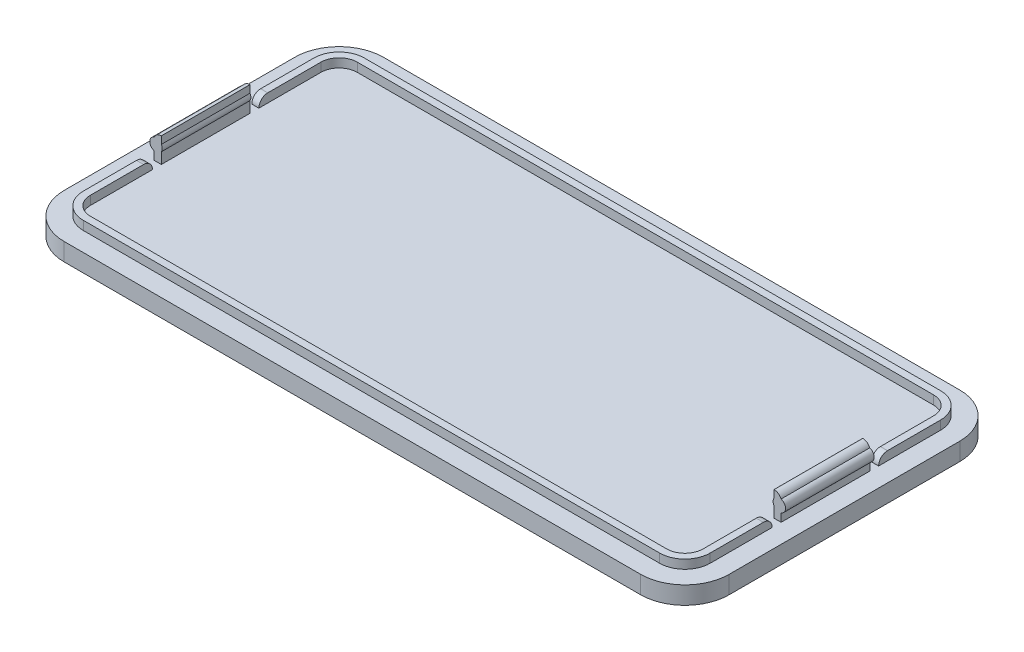
from build123d import *

# Parameters (mm, degrees)
EXTRUDE_2_DEPTH     = 2
EXTRUDE_4_DEPTH     = 1
SKETCH_7_W          = 0.8
SKETCH_7_H          = 10
EXTRUDE_8_DEPTH     = 2.8
SKETCH_8_R          = 0.7
EXTRUDE_9_DEPTH     = 10
FILLET_1_R          = 0.85
SKETCH_11_W         = 1
SKETCH_11_H         = 1
CUT_EXTRUDE_1_DEPTH = 1.2
FILLET_2_R          = 1
SKETCH_12_W         = 0.815007945
SKETCH_12_H         = 4.86663949
CUT_EXTRUDE_2_DEPTH = 0.5
SKETCH_13_W         = 0.8
SKETCH_13_H         = 10
EXTRUDE_10_DEPTH    = 1.8
SKETCH_14_R         = 0.7
EXTRUDE_11_DEPTH    = 10
FILLET_3_R          = 0.85
SKETCH_15_W         = 0.8
SKETCH_15_H         = 1
CUT_EXTRUDE_3_DEPTH = 1
FILLET_4_R          = 1


# Some blends are built 0.0001 mm under size
with BuildPart() as part:
    # case 2 → 凸台-拉伸2 (new body)
    with BuildSketch(Plane(origin=(0, 0, 0), x_dir=(1, 0, 0), z_dir=(0, 1, 0))):
        with BuildLine():
            Line((-34.042196447, 18), (30.957803553, 18))
            ThreePointArc((30.957803553, 18), (34.493337459, 16.535533906), (35.957803553, 13))
            Line((35.957803553, 13), (35.957803553, -13))
            ThreePointArc((35.957803553, -13), (34.493337459, -16.535533906), (30.957803553, -18))
            Line((30.957803553, -18), (-34.042196447, -18))
            ThreePointArc((-34.042196447, -18), (-37.577730353, -16.535533906), (-39.042196447, -13))
            Line((-39.042196447, -13), (-39.042196447, 13))
            ThreePointArc((-39.042196447, 13), (-37.577730353, 16.535533906), (-34.042196447, 18))
        make_face()
    extrude(amount=EXTRUDE_2_DEPTH)

    # 草图3 → 凸台-拉伸4 (add)
    with BuildSketch(Plane(origin=(0, 2, 0), x_dir=(1, 0, 0), z_dir=(0, 1, 0))):
        with BuildLine():
            Line((-36.892196447, 13), (-36.892196447, -13))
            ThreePointArc((-36.892196447, -13), (-36.057450774, -15.015254326), (-34.042196447, -15.85))
            Line((-34.042196447, -15.85), (30.957803553, -15.85))
            ThreePointArc((30.957803553, -15.85), (32.973057879, -15.015254326), (33.807803553, -13))
            Line((33.807803553, -13), (33.807803553, 13))
            ThreePointArc((33.807803553, 13), (32.973057879, 15.015254326), (30.957803553, 15.85))
            Line((30.957803553, 15.85), (-34.042196447, 15.85))
            ThreePointArc((-34.042196447, 15.85), (-36.057450774, 15.015254326), (-36.892196447, 13))
        make_face()
        with BuildLine():
            Line((-34.042196447, -15.05), (30.957803553, -15.05))
            ThreePointArc((30.957803553, -15.05), (32.407372454, -14.449568901), (33.007803553, -13))
            Line((33.007803553, -13), (33.007803553, 13))
            ThreePointArc((33.007803553, 13), (32.407372454, 14.449568901), (30.957803553, 15.05))
            Line((30.957803553, 15.05), (-34.042196447, 15.05))
            ThreePointArc((-34.042196447, 15.05), (-35.491765349, 14.449568901), (-36.092196447, 13))
            Line((-36.092196447, 13), (-36.092196447, -13))
            ThreePointArc((-36.092196447, -13), (-35.491765349, -14.449568901), (-34.042196447, -15.05))
        make_face(mode=Mode.SUBTRACT)
    extrude(amount=EXTRUDE_4_DEPTH)

    # 草图7 → 凸台-拉伸8 (add)
    with BuildSketch(Plane(origin=(0, 2, 0), x_dir=(1, 0, 0), z_dir=(0, 1, 0))):
        with Locations((-36.492196447, 0)):
            Rectangle(SKETCH_7_W, SKETCH_7_H)
    extrude(amount=EXTRUDE_8_DEPTH)

    # 草图8 → 凸台-拉伸9 (add)
    with BuildSketch(Plane.XY.offset(5)):
        with Locations((-36.692196447, 3.6)):
            Circle(SKETCH_8_R)
    extrude(amount=-EXTRUDE_9_DEPTH)

    # 圆角1
    # the kernel refuses this fillet: 0.85 mm, written as the material it takes off along each edge
    with BuildSketch(Plane(origin=(-36.892196447, 4.8, 6.967826014), x_dir=(0, -1, 0), z_dir=(0, 0, -1))) as fillet_1_piece_1:
        with BuildLine():
            CenterArc((0.85, -0.787130406), FILLET_1_R, 112.174937704, 67.825062296)
            Line((0, -0.787130406), (-0.017, -0.787130406))
            Line((-0.017, -0.787130406), (-0.017, 0))
            Line((-0.017, 0), (0, 0.017))
            ThreePointArc((0, 0.017), (0.264589803, 0.017), (0.522763199, 0.015742608))
            Line((0.522763199, 0.015742608), (0.529179607, 0))
        make_face()
    extrude(amount=13.935652028, mode=Mode.SUBTRACT)

    # 草图11 → 切除-拉伸1 (cut)
    with BuildSketch(Plane.ZY.offset(36.892196447)):
        with Locations((5.5, 2.5)):
            Rectangle(SKETCH_11_W, SKETCH_11_H)
        with Locations((-5.5, 2.5)):
            Rectangle(SKETCH_11_W, SKETCH_11_H)
    extrude(amount=-CUT_EXTRUDE_1_DEPTH, mode=Mode.SUBTRACT)

    # 圆角2
    fillet_2_edges = [part.edges().sort_by_distance(p)[0] for p in [
        (-36.492196447, 3, 6),
        (-36.492196447, 3, -6),
    ]]
    fillet(fillet_2_edges, radius=FILLET_2_R - 0.0001)  # a hair under: the kernel refuses the full size

    # 草图12 → 切除-拉伸2 (cut)
    # profile 1 of 9: a face of its own
    with BuildSketch(Plane(origin=(0, 0, 0), x_dir=(-1, 0, 0), z_dir=(0, -1, 0))):
        with BuildLine():
            Line((-8.199275743, 5.02603156), (-9.01984878, 5.499029726))
            Line((-9.01984878, 5.499029726), (-13.276727931, 7.955148964))
            Line((-13.276727931, 7.955148964), (-14.097300969, 8.433851351))
            add(Edge.make_bspline(
                [(-14.097300969, 8.433851351), (-14.365190658, 8.581987184), (-14.661462323, 8.661776712), (-14.957803553, 8.661776712)],
                knots=[3, 3, 3, 3, 4, 4, 4, 4], degree=3))
            add(Edge.make_bspline(
                [(-14.957803553, 8.661776712), (-15.254144782, 8.661776712), (-15.550486011, 8.581987184), (-15.818306136, 8.433851351)],
                knots=[4, 4, 4, 4, 5, 5, 5, 5], degree=3))
            Line((-15.818306136, 8.433851351), (-16.638948738, 7.955148964))
            Line((-16.638948738, 7.955148964), (-20.895827889, 5.499029726))
            Line((-20.895827889, 5.499029726), (-21.71647049, 5.02603156))
            add(Edge.make_bspline(
                [(-21.71647049, 5.02603156), (-22.24640652, 4.718316671), (-22.576973074, 4.148451095), (-22.576973074, 3.538690756)],
                knots=[8, 8, 8, 8, 9, 9, 9, 9], degree=3))
            Line((-22.576973074, 3.538690756), (-22.576973074, -3.276914044))
            add(Edge.make_bspline(
                [(-22.576973074, -3.276914044), (-22.576973074, -3.892343823), (-22.24640652, -4.456539959), (-21.71647049, -4.764254848)],
                knots=[10, 10, 10, 10, 11, 11, 11, 11], degree=3))
            Line((-21.71647049, -4.764254848), (-20.895827889, -5.237253014))
            Line((-20.895827889, -5.237253014), (-16.638948738, -7.693372252))
            Line((-16.638948738, -7.693372252), (-15.818306136, -8.172039857))
            add(Edge.make_bspline(
                [(-15.818306136, -8.172039857), (-15.550486011, -8.325914693), (-15.254144782, -8.4), (-14.957803553, -8.4)],
                knots=[14, 14, 14, 14, 15, 15, 15, 15], degree=3))
            add(Edge.make_bspline(
                [(-14.957803553, -8.4), (-14.661462323, -8.4), (-14.365190658, -8.325914693), (-14.097300969, -8.172039857)],
                knots=[15, 15, 15, 15, 16, 16, 16, 16], degree=3))
            Line((-14.097300969, -8.172039857), (-13.276727931, -7.693372252))
            Line((-13.276727931, -7.693372252), (-9.01984878, -5.237253014))
            Line((-9.01984878, -5.237253014), (-8.199275743, -4.764254848))
            add(Edge.make_bspline(
                [(-8.199275743, -4.764254848), (-7.663565929, -4.456539959), (-7.338773159, -3.892343823), (-7.338773159, -3.276914044)],
                knots=[19, 19, 19, 19, 20, 20, 20, 20], degree=3))
            Line((-7.338773159, -3.276914044), (-7.338773159, 3.538690756))
            add(Edge.make_bspline(
                [(-7.338773159, 3.538690756), (-7.338773159, 4.148451095), (-7.663565929, 4.718316671), (-8.199275743, 5.02603156)],
                knots=[21, 21, 21, 21, 22, 22, 22, 22], degree=3))
        make_face()
        with BuildLine():
            Line((-20.622303543, 4.347890134), (-15.356751194, 7.390987609))
            add(Edge.make_bspline(
                [(-15.356751194, 7.390987609), (-15.111678388, 7.533454003), (-14.803928717, 7.533454003), (-14.553221255, 7.390987609)],
                knots=[3, 3, 3, 3, 4, 4, 4, 4], degree=3))
            Line((-14.553221255, 7.390987609), (-9.31619001, 4.342185913))
            add(Edge.make_bspline(
                [(-9.31619001, 4.342185913), (-9.048369885, 4.188345859), (-9.042665664, 3.800841442), (-9.310485789, 3.641262386)],
                knots=[5, 5, 5, 5, 6, 6, 6, 6], degree=3))
            Line((-9.310485789, 3.641262386), (-14.399346419, 0.598199692))
            add(Edge.make_bspline(
                [(-14.399346419, 0.598199692), (-14.741321415, 0.398725872), (-15.168720597, 0.398725872), (-15.510626029, 0.598199692)],
                knots=[7, 7, 7, 7, 8, 8, 8, 8], degree=3))
            add(Edge.make_bspline(
                [(-15.510626029, 0.598199692), (-20.662163525, 3.572881299), (-20.673571967, 3.57858552)],
                knots=[0, 0, 0, 1, 1, 1], degree=2))
            add(Edge.make_bspline(
                [(-20.673571967, 3.57858552), (-20.941392092, 3.772320338), (-20.912940551, 4.182641639), (-20.622303543, 4.347890134)],
                knots=[1, 1, 1, 1, 2, 2, 2, 2], degree=3))
        make_face(mode=Mode.SUBTRACT)
        with BuildLine():
            Line((-12.820807646, -4.559111588), (-13.413490104, -4.889608579))
            Line((-13.413490104, -4.889608579), (-13.413490104, -3.806884855))
            Line((-13.413490104, -3.806884855), (-12.889258296, -3.544734169))
            add(Edge.make_bspline(
                [(-11.931853522, -2.159964996), (-11.931853522, -2.701344248), (-12.239533629, -3.180011854), (-12.889258296, -3.544734169)],
                knots=[0, 0, 0, 0, 1, 1, 1, 1], degree=3))
            add(Edge.make_bspline(
                [(-12.923414057, -1.971899617), (-12.285167396, -1.607212083), (-11.931853522, -1.601507862), (-11.931853522, -2.159964996)],
                knots=[6, 6, 6, 6, 7, 7, 7, 7], degree=3))
            Line((-12.923414057, -1.971899617), (-13.413490104, -2.245458745))
            add(Edge.make_bspline(
                [(-13.470532313, -2.342326153), (-13.470532313, -2.302431389), (-13.44771543, -2.262536625), (-13.413490104, -2.245458745)],
                knots=[4, 4, 4, 4, 5, 5, 5, 5], degree=3))
            Line((-13.470532313, -2.342326153), (-13.470532313, -3.687200563))
            Line((-13.470532313, -3.687200563), (-13.470532313, -4.98651077))
            Line((-13.470532313, -4.98651077), (-13.470532313, -6.696107495))
            add(Edge.make_bspline(
                [(-13.470532313, -6.696107495), (-13.470532313, -6.736002259), (-13.487575412, -6.770192803), (-13.527435394, -6.792974904)],
                knots=[3, 3, 3, 3, 4, 4, 4, 4], degree=3))
            Line((-13.527435394, -6.792974904), (-14.633010783, -7.419813124))
            add(Edge.make_bspline(
                [(-14.633010783, -7.419813124), (-14.70709609, -7.459707888), (-14.79829406, -7.408439464), (-14.79829406, -7.322945715)],
                knots=[5, 5, 5, 5, 6, 6, 6, 6], degree=3))
            Line((-14.79829406, -7.322945715), (-14.79829406, -2.045984924))
            add(Edge.make_bspline(
                [(-14.79829406, -2.045984924), (-14.79829406, -2.00609016), (-14.781181398, -1.966195396), (-14.741321415, -1.949117515)],
                knots=[7, 7, 7, 7, 8, 8, 8, 8], degree=3))
            Line((-14.741321415, -1.949117515), (-12.860737192, -0.883471672))
            add(Edge.make_bspline(
                [(-12.860737192, -0.883471672), (-11.641216513, -0.193921805), (-10.632612879, -0.057159632), (-10.632612879, -1.424850925)],
                knots=[9, 9, 9, 9, 10, 10, 10, 10], degree=3))
            add(Edge.make_bspline(
                [(-10.632612879, -1.424850925), (-10.632612879, -2.741239012), (-11.652624955, -3.898048043), (-12.820807646, -4.559111588)],
                knots=[10, 10, 10, 10, 11, 11, 11, 11], degree=3))
        make_face(mode=Mode.SUBTRACT)
        with BuildLine():
            Line((-8.917311932, -4.205797714), (-10.011409316, -4.826931714))
            add(Edge.make_bspline(
                [(-10.011409316, -4.826931714), (-10.085494623, -4.866826478), (-10.176692593, -4.815523272), (-10.176692593, -4.730064305)],
                knots=[2, 2, 2, 2, 3, 3, 3, 3], degree=3))
            Line((-10.176692593, -4.730064305), (-10.176692593, -2.21693764))
            add(Edge.make_bspline(
                [(-10.176692593, -2.21693764), (-10.176692593, -2.177077658), (-10.15387571, -2.142852333), (-10.119650385, -2.120070231)],
                knots=[4, 4, 4, 4, 5, 5, 5, 5], degree=3))
            Line((-10.119650385, -2.120070231), (-9.025553001, -1.504605671))
            add(Edge.make_bspline(
                [(-9.025553001, -1.504605671), (-8.951467694, -1.464745689), (-8.860269724, -1.516014113), (-8.860269724, -1.601507862)],
                knots=[6, 6, 6, 6, 7, 7, 7, 7], degree=3))
            Line((-8.860269724, -1.601507862), (-8.860269724, -4.108895524))
            add(Edge.make_bspline(
                [(-8.860269724, -4.108895524), (-8.860269724, -4.148790288), (-8.883086607, -4.188685052), (-8.917311932, -4.205797714)],
                knots=[0, 0, 0, 0, 1, 1, 1, 1], degree=3))
        make_face(mode=Mode.SUBTRACT)
        with BuildLine():
            add(Edge.make_bspline(
                [(-9.515629048, 0.16509629), (-9.076821425, 0.415838534), (-8.763437097, 0.307562684), (-8.763437097, -0.091350175), (-8.763437097, -0.484558813), (-9.076821425, -0.946148538), (-9.515629048, -1.191186561)],
                knots=[2, 2, 2, 2, 3, 3, 3, 4, 4, 4, 4], degree=3))
            add(Edge.make_bspline(
                [(-9.515629048, -1.191186561), (-9.960071328, -1.447633027), (-10.27352522, -1.339357176), (-10.27352522, -0.946148538), (-10.27352522, -0.541531458), (-9.960071328, -0.085645954), (-9.515629048, 0.16509629)],
                knots=[0, 0, 0, 0, 1, 1, 1, 2, 2, 2, 2], degree=3))
        make_face(mode=Mode.SUBTRACT)
    # profile 2 of 9: a face of its own
    with BuildSketch(Plane(origin=(0, 0, 0), x_dir=(-1, 0, 0), z_dir=(0, -1, 0))):
        with BuildLine():
            Line((-3.344009912, 3.059988369), (-5.218889915, 3.059988369))
            Line((-5.218889915, 3.059988369), (-5.218889915, -3.504839405))
            Line((-5.218889915, -3.504839405), (-4.386838872, -3.504839405))
            Line((-4.386838872, -3.504839405), (-4.386838872, -0.900549553))
            Line((-4.386838872, -0.900549553), (-3.298376145, -0.900549553))
            add(Edge.make_bspline(
                [(-3.298376145, -0.900549553), (-1.868007986, -0.900549553), (-0.882151672, -0.250929231), (-0.882151672, 1.133874724)],
                knots=[5, 5, 5, 5, 6, 6, 6, 6], degree=3))
            add(Edge.make_bspline(
                [(-0.882151672, 1.133874724), (-0.882151672, 2.569912322), (-1.868007986, 3.059988369), (-3.344009912, 3.059988369)],
                knots=[6, 6, 6, 6, 7, 7, 7, 7], degree=3))
        make_face()
        with BuildLine():
            Line((-3.406617214, -0.228112348), (-4.386838872, -0.228112348))
            Line((-4.386838872, -0.228112348), (-4.386838872, 2.387551164))
            Line((-4.386838872, 2.387551164), (-3.440842539, 2.387551164))
            add(Edge.make_bspline(
                [(-3.440842539, 2.387551164), (-2.289702947, 2.387551164), (-1.70842893, 2.085540496), (-1.70842893, 1.133874724)],
                knots=[3, 3, 3, 3, 4, 4, 4, 4], degree=3))
            add(Edge.make_bspline(
                [(-1.70842893, 1.133874724), (-1.70842893, 0.193582612), (-2.249842965, -0.228112348), (-3.406617214, -0.228112348)],
                knots=[4, 4, 4, 4, 5, 5, 5, 5], degree=3))
        make_face(mode=Mode.SUBTRACT)
    # profile 3 of 9: a face of its own
    with BuildSketch(Plane(origin=(0, 0, 0), x_dir=(-1, 0, 0), z_dir=(0, -1, 0))):
        with Locations((0.602337022, -1.07151966)):
            Rectangle(SKETCH_12_W, SKETCH_12_H)
    # profile 4 of 9: a face of its own
    with BuildSketch(Plane(origin=(0, 0, 0), x_dir=(-1, 0, 0), z_dir=(0, -1, 0))):
        with BuildLine():
            Line((5.716866646, 0.2847458), (4.884885167, 0.615277573))
            add(Edge.make_bspline(
                [(4.884885167, 0.615277573), (4.297906929, 0.848941937), (3.876211968, 0.99140833), (3.876211968, 1.361800085)],
                knots=[1, 1, 1, 1, 2, 2, 2, 2], degree=3))
            add(Edge.make_bspline(
                [(3.876211968, 1.361800085), (3.876211968, 1.715113959), (4.178257418, 1.91458778), (4.674037686, 1.91458778)],
                knots=[2, 2, 2, 2, 3, 3, 3, 3], degree=3))
            add(Edge.make_bspline(
                [(4.674037686, 1.91458778), (5.192565274, 1.91458778), (5.602921356, 1.737930843), (6.041659416, 1.401694849)],
                knots=[3, 3, 3, 3, 4, 4, 4, 4], degree=3))
            Line((6.041659416, 1.401694849), (6.839554697, 2.404663827))
            add(Edge.make_bspline(
                [(6.839554697, 2.404663827), (6.25828068, 2.991607282), (5.4433423, 3.287948512), (4.674037686, 3.287948512)],
                knots=[5, 5, 5, 5, 6, 6, 6, 6], degree=3))
            add(Edge.make_bspline(
                [(4.674037686, 3.287948512), (3.255077969, 3.287948512), (2.252108992, 2.387551164), (2.252108992, 1.270636897)],
                knots=[6, 6, 6, 6, 7, 7, 7, 7], degree=3))
            add(Edge.make_bspline(
                [(2.252108992, 1.270636897), (2.252108992, 0.301858463), (2.907398752, -0.279415554), (3.608391843, -0.558644121)],
                knots=[7, 7, 7, 7, 8, 8, 8, 8], degree=3))
            Line((3.608391843, -0.558644121), (4.457485985, -0.917662216))
            add(Edge.make_bspline(
                [(4.457485985, -0.917662216), (5.02735156, -1.156996018), (5.397778097, -1.282384531), (5.397778097, -1.669888949)],
                knots=[9, 9, 9, 9, 10, 10, 10, 10], degree=3))
            add(Edge.make_bspline(
                [(5.397778097, -1.669888949), (5.397778097, -2.028907043), (5.11854953, -2.251128184), (4.525867072, -2.251128184)],
                knots=[10, 10, 10, 10, 11, 11, 11, 11], degree=3))
            add(Edge.make_bspline(
                [(4.525867072, -2.251128184), (4.001635263, -2.251128184), (3.3804317, -1.971899617), (2.907398752, -1.567317319)],
                knots=[11, 11, 11, 11, 12, 12, 12, 12], degree=3))
            Line((2.907398752, -1.567317319), (2.001401529, -2.672857926))
            add(Edge.make_bspline(
                [(2.001401529, -2.672857926), (2.690916615, -3.305400367), (3.625434942, -3.630227918), (4.491641747, -3.630227918)],
                knots=[13, 13, 13, 13, 14, 14, 14, 14], degree=3))
            add(Edge.make_bspline(
                [(4.491641747, -3.630227918), (6.104405845, -3.630227918), (7.038924172, -2.655745263), (7.038924172, -1.544500435)],
                knots=[14, 14, 14, 14, 15, 15, 15, 15], degree=3))
            add(Edge.make_bspline(
                [(7.038924172, -1.544500435), (7.038924172, -0.604243106), (6.543213468, -0.04575119), (5.716866646, 0.2847458)],
                knots=[15, 15, 15, 15, 16, 16, 16, 16], degree=3))
        make_face()
    # profile 5 of 9: a face of its own
    with BuildSketch(Plane(origin=(0, 0, 0), x_dir=(-1, 0, 0), z_dir=(0, -1, 0))):
        with BuildLine():
            Line((10.822909503, 1.589760228), (10.822909503, -1.749678477))
            add(Edge.make_bspline(
                [(10.822909503, -1.749678477), (10.555089378, -2.125774452), (10.332763892, -2.268240846), (9.973815361, -2.268240846)],
                knots=[1, 1, 1, 1, 2, 2, 2, 2], degree=3))
            add(Edge.make_bspline(
                [(9.973815361, -2.268240846), (9.569163499, -2.268240846), (9.381132902, -2.068801808), (9.381132902, -1.362139278)],
                knots=[2, 2, 2, 2, 3, 3, 3, 3], degree=3))
            Line((9.381132902, -1.362139278), (9.381132902, 1.589760228))
            Line((9.381132902, 1.589760228), (7.791185687, 1.589760228))
            Line((7.791185687, 1.589760228), (7.791185687, -1.561613098))
            add(Edge.make_bspline(
                [(7.791185687, -1.561613098), (7.791185687, -2.8324022), (8.264218635, -3.630227918), (9.375428681, -3.630227918)],
                knots=[6, 6, 6, 6, 7, 7, 7, 7], degree=3))
            add(Edge.make_bspline(
                [(9.375428681, -3.630227918), (10.070647988, -3.630227918), (10.549385157, -3.305400367), (10.971080117, -2.803915878)],
                knots=[7, 7, 7, 7, 8, 8, 8, 8], degree=3))
            Line((10.971080117, -2.803915878), (11.005235879, -2.803915878))
            Line((11.005235879, -2.803915878), (11.119250732, -3.504839405))
            Line((11.119250732, -3.504839405), (12.418491375, -3.504839405))
            Line((12.418491375, -3.504839405), (12.418491375, 1.589760228))
            Line((12.418491375, 1.589760228), (10.822909503, 1.589760228))
        make_face()
    # profile 6 of 9: a face of its own
    with BuildSketch(Plane(origin=(0, 0, 0), x_dir=(-1, 0, 0), z_dir=(0, -1, 0))):
        with BuildLine():
            Line((16.270788228, -2.501870428), (15.467258289, -2.501870428))
            add(Edge.make_bspline(
                [(15.467258289, -2.501870428), (14.920209598, -2.501870428), (14.715066338, -2.393594577), (14.715066338, -2.159964996)],
                knots=[1, 1, 1, 1, 2, 2, 2, 2], degree=3))
            add(Edge.make_bspline(
                [(14.715066338, -2.159964996), (14.715066338, -1.989012279), (14.75492632, -1.909222751), (14.874575831, -1.800946901)],
                knots=[2, 2, 2, 2, 3, 3, 3, 3], degree=3))
            add(Edge.make_bspline(
                [(14.874575831, -1.800946901), (15.096901316, -1.863623766), (15.301975012, -1.892144871), (15.47296251, -1.892144871)],
                knots=[3, 3, 3, 3, 4, 4, 4, 4], degree=3))
            add(Edge.make_bspline(
                [(15.47296251, -1.892144871), (16.601285219, -1.892144871), (17.507421569, -1.373547719), (17.507421569, -0.182548145)],
                knots=[4, 4, 4, 4, 5, 5, 5, 5], degree=3))
            add(Edge.make_bspline(
                [(17.507421569, -0.182548145), (17.507421569, 0.06252466), (17.44467514, 0.296154242), (17.364955175, 0.438620636)],
                knots=[5, 5, 5, 5, 6, 6, 6, 6], degree=3))
            Line((17.364955175, 0.438620636), (18.151302888, 0.438620636))
            Line((18.151302888, 0.438620636), (18.151302888, 1.589760228))
            Line((18.151302888, 1.589760228), (16.28219667, 1.589760228))
            add(Edge.make_bspline(
                [(16.28219667, 1.589760228), (16.048532306, 1.675219195), (15.769303739, 1.715113959), (15.47296251, 1.715113959)],
                knots=[9, 9, 9, 9, 10, 10, 10, 10], degree=3))
            add(Edge.make_bspline(
                [(15.47296251, 1.715113959), (14.373160906, 1.715113959), (13.341670824, 1.111057841), (13.341670824, -0.13694916)],
                knots=[10, 10, 10, 10, 11, 11, 11, 11], degree=3))
            add(Edge.make_bspline(
                [(13.341670824, -0.13694916), (13.341670824, -0.729596837), (13.672237378, -1.202595003), (14.03118591, -1.453337247)],
                knots=[11, 11, 11, 11, 12, 12, 12, 12], degree=3))
            Line((14.03118591, -1.453337247), (14.03118591, -1.487527791))
            add(Edge.make_bspline(
                [(14.03118591, -1.487527791), (13.700688919, -1.721157372), (13.467024555, -2.080175467), (13.467024555, -2.439193562)],
                knots=[13, 13, 13, 13, 14, 14, 14, 14], degree=3))
            add(Edge.make_bspline(
                [(13.467024555, -2.439193562), (13.467024555, -2.866592744), (13.666533158, -3.134447651), (13.934353283, -3.316808808)],
                knots=[14, 14, 14, 14, 15, 15, 15, 15], degree=3))
            Line((13.934353283, -3.316808808), (13.934353283, -3.362373012))
            add(Edge.make_bspline(
                [(13.934353283, -3.362373012), (13.461320335, -3.601741596), (13.210612872, -3.943647028), (13.210612872, -4.365341989)],
                knots=[16, 16, 16, 16, 17, 17, 17, 17], degree=3))
            add(Edge.make_bspline(
                [(13.210612872, -4.365341989), (13.210612872, -5.277112996), (14.173652304, -5.647539533), (15.347608779, -5.647539533)],
                knots=[17, 17, 17, 17, 18, 18, 18, 18], degree=3))
            add(Edge.make_bspline(
                [(15.347608779, -5.647539533), (17.11988237, -5.647539533), (18.23116198, -4.88393914), (18.23116198, -3.806884855)],
                knots=[18, 18, 18, 18, 19, 19, 19, 19], degree=3))
            add(Edge.make_bspline(
                [(18.23116198, -3.806884855), (18.23116198, -2.883705406), (17.524534232, -2.501870428), (16.270788228, -2.501870428)],
                knots=[19, 19, 19, 19, 20, 20, 20, 20], degree=3))
        make_face()
        with BuildLine():
            Line((15.484370952, -3.721391106), (15.968812342, -3.721391106))
            add(Edge.make_bspline(
                [(15.968812342, -3.721391106), (16.441706162, -3.721391106), (16.709595851, -3.784067972), (16.709595851, -4.086113422)],
                knots=[4, 4, 4, 4, 5, 5, 5, 5], degree=3))
            add(Edge.make_bspline(
                [(16.709595851, -4.086113422), (16.709595851, -4.410940974), (16.253745129, -4.650274776), (15.598316241, -4.650274776)],
                knots=[5, 5, 5, 5, 6, 6, 6, 6], degree=3))
            add(Edge.make_bspline(
                [(15.598316241, -4.650274776), (14.943026481, -4.650274776), (14.5156273, -4.473617839), (14.5156273, -4.114599745)],
                knots=[0, 0, 0, 0, 1, 1, 1, 1], degree=3))
            add(Edge.make_bspline(
                [(14.5156273, -4.114599745), (14.5156273, -3.943647028), (14.595347264, -3.801180635), (14.75492632, -3.658714241)],
                knots=[1, 1, 1, 1, 2, 2, 2, 2], degree=3))
            add(Edge.make_bspline(
                [(14.75492632, -3.658714241), (14.920209598, -3.704313226), (15.114013979, -3.721391106), (15.484370952, -3.721391106)],
                knots=[2, 2, 2, 2, 3, 3, 3, 3], degree=3))
        make_face(mode=Mode.SUBTRACT)
        with BuildLine():
            add(Edge.make_bspline(
                [(15.47296251, -0.934740096), (15.108309758, -0.934740096), (14.829081191, -0.666919971), (14.829081191, -0.13694916), (14.829081191, 0.381647991), (15.108309758, 0.649468116), (15.47296251, 0.649468116)],
                knots=[2, 2, 2, 2, 3, 3, 3, 4, 4, 4, 4], degree=3))
            add(Edge.make_bspline(
                [(15.47296251, 0.649468116), (15.849093268, 0.649468116), (16.116913393, 0.381647991), (16.116913393, -0.13694916), (16.116913393, -0.666919971), (15.849093268, -0.934740096), (15.47296251, -0.934740096)],
                knots=[0, 0, 0, 0, 1, 1, 1, 2, 2, 2, 2], degree=3))
        make_face(mode=Mode.SUBTRACT)
    # profile 7 of 9: a face of its own
    with BuildSketch(Plane(origin=(0, 0, 0), x_dir=(-1, 0, 0), z_dir=(0, -1, 0))):
        with BuildLine():
            Line((18.607223174, 1.048380975), (19.165680307, -0.000186987))
            add(Edge.make_bspline(
                [(19.165680307, -0.000186987), (19.67293858, 0.2847458), (20.094633541, 0.444324857), (20.499215839, 0.444324857)],
                knots=[2, 2, 2, 2, 3, 3, 3, 3], degree=3))
            add(Edge.make_bspline(
                [(20.499215839, 0.444324857), (21.017743426, 0.444324857), (21.234364691, 0.204991054), (21.268520453, -0.205330247)],
                knots=[3, 3, 3, 3, 4, 4, 4, 4], degree=3))
            add(Edge.make_bspline(
                [(21.268520453, -0.205330247), (19.27969516, -0.421881948), (18.436235676, -1.003121183), (18.436235676, -2.080175467)],
                knots=[4, 4, 4, 4, 5, 5, 5, 5], degree=3))
            add(Edge.make_bspline(
                [(18.436235676, -2.080175467), (18.436235676, -2.929269609), (19.011805472, -3.630227918), (19.952167147, -3.630227918)],
                knots=[5, 5, 5, 5, 6, 6, 6, 6], degree=3))
            add(Edge.make_bspline(
                [(19.952167147, -3.630227918), (20.516328501, -3.630227918), (20.989291886, -3.368077232), (21.410986846, -2.991981257)],
                knots=[6, 6, 6, 6, 7, 7, 7, 7], degree=3))
            Line((21.410986846, -2.991981257), (21.450846829, -2.991981257))
            Line((21.450846829, -2.991981257), (21.564792118, -3.504839405))
            Line((21.564792118, -3.504839405), (22.864102325, -3.504839405))
            Line((22.864102325, -3.504839405), (22.864102325, -0.609947326))
            add(Edge.make_bspline(
                [(22.864102325, -0.609947326), (22.864102325, 0.98570411), (22.117614594, 1.715113959), (20.801261289, 1.715113959)],
                knots=[11, 11, 11, 11, 12, 12, 12, 12], degree=3))
            add(Edge.make_bspline(
                [(20.801261289, 1.715113959), (20.009070228, 1.715113959), (19.27969516, 1.447293834), (18.607223174, 1.048380975)],
                knots=[0, 0, 0, 0, 1, 1, 1, 1], degree=3))
        make_face()
        with BuildLine():
            Line((21.268520453, -1.174108681), (21.268520453, -1.989012279))
            add(Edge.make_bspline(
                [(21.268520453, -1.989012279), (21.034856089, -2.239754524), (20.824008609, -2.393594577), (20.499215839, -2.393594577)],
                knots=[0, 0, 0, 0, 1, 1, 1, 1], degree=3))
            add(Edge.make_bspline(
                [(20.499215839, -2.393594577), (20.168649284, -2.393594577), (19.952167147, -2.251128184), (19.952167147, -1.954821736)],
                knots=[1, 1, 1, 1, 2, 2, 2, 2], degree=3))
            add(Edge.make_bspline(
                [(19.952167147, -1.954821736), (19.952167147, -1.595803641), (20.276959917, -1.310870854), (21.268520453, -1.174108681)],
                knots=[2, 2, 2, 2, 3, 3, 3, 3], degree=3))
        make_face(mode=Mode.SUBTRACT)
    # profile 8 of 9: a face of its own
    with BuildSketch(Plane(origin=(0, 0, 0), x_dir=(-1, 0, 0), z_dir=(0, -1, 0))):
        with BuildLine():
            Line((25.354481669, 0.706475543), (25.320256344, 0.706475543))
            Line((25.320256344, 0.706475543), (25.212015276, 1.589760228))
            Line((25.212015276, 1.589760228), (23.912705069, 1.589760228))
            Line((23.912705069, 1.589760228), (23.912705069, -3.504839405))
            Line((23.912705069, -3.504839405), (25.496948063, -3.504839405))
            Line((25.496948063, -3.504839405), (25.496948063, -0.592834664))
            add(Edge.make_bspline(
                [(25.496948063, -0.592834664), (25.764768188, 0.079602541), (26.220688474, 0.318936344), (26.596749668, 0.318936344)],
                knots=[7, 7, 7, 7, 8, 8, 8, 8], degree=3))
            add(Edge.make_bspline(
                [(26.596749668, 0.318936344), (26.82470981, 0.318936344), (26.972880425, 0.2847458), (27.155206801, 0.239181597)],
                knots=[8, 8, 8, 8, 9, 9, 9, 9], degree=3))
            Line((27.155206801, 0.239181597), (27.423026926, 1.612542329))
            add(Edge.make_bspline(
                [(27.423026926, 1.612542329), (27.280560532, 1.675219195), (27.109642598, 1.715113959), (26.807597148, 1.715113959)],
                knots=[10, 10, 10, 10, 11, 11, 11, 11], degree=3))
            add(Edge.make_bspline(
                [(26.807597148, 1.715113959), (26.294704217, 1.715113959), (25.730542863, 1.384582187), (25.354481669, 0.706475543)],
                knots=[0, 0, 0, 0, 1, 1, 1, 1], degree=3))
        make_face()
    # profile 9 of 9: a face of its own
    with BuildSketch(Plane(origin=(0, 0, 0), x_dir=(-1, 0, 0), z_dir=(0, -1, 0))):
        with BuildLine():
            add(Edge.make_bspline(
                [(0.605189132, 2.364769063), (0.929981902, 2.364769063), (1.169350486, 2.587024984), (1.169350486, 2.889035653), (1.169350486, 3.225271646), (0.929981902, 3.419006464), (0.605189132, 3.419006464)],
                knots=[2, 2, 2, 2, 3, 3, 3, 4, 4, 4, 4], degree=3))
            add(Edge.make_bspline(
                [(0.605189132, 3.419006464), (0.280396362, 3.419006464), (0.041027778, 3.225271646), (0.041027778, 2.889035653), (0.041027778, 2.587024984), (0.280396362, 2.364769063), (0.605189132, 2.364769063)],
                knots=[0, 0, 0, 0, 1, 1, 1, 2, 2, 2, 2], degree=3))
        make_face()
    extrude(amount=-CUT_EXTRUDE_2_DEPTH, mode=Mode.SUBTRACT)

    # 草图13 → 凸台-拉伸10 (add)
    with BuildSketch(Plane(origin=(0, 3, 0), x_dir=(1, 0, 0), z_dir=(0, 1, 0))):
        with Locations((33.407803553, 0)):
            Rectangle(SKETCH_13_W, SKETCH_13_H)
    extrude(amount=EXTRUDE_10_DEPTH)

    # 草图14 → 凸台-拉伸11 (add)
    with BuildSketch(Plane.XY.offset(5)):
        with Locations((33.607803553, 3.6)):
            Circle(SKETCH_14_R)
    extrude(amount=-EXTRUDE_11_DEPTH)

    # 圆角3
    # the kernel refuses this fillet: 0.85 mm, written as the material it takes off along each edge
    with BuildSketch(Plane(origin=(33.807803553, 4.8, -6.967826014), x_dir=(0, -1, 0), z_dir=(0, 0, 1))) as fillet_3_piece_1:
        with BuildLine():
            CenterArc((0.85, -0.787130406), FILLET_3_R, 112.174937704, 67.825062296)
            Line((0, -0.787130406), (-0.017, -0.787130406))
            Line((-0.017, -0.787130406), (-0.017, 0))
            Line((-0.017, 0), (0, 0.017))
            ThreePointArc((0, 0.017), (0.264589803, 0.017), (0.522763199, 0.015742608))
            Line((0.522763199, 0.015742608), (0.529179607, 0))
        make_face()
    extrude(amount=13.935652028, mode=Mode.SUBTRACT)

    # 草图15 → 切除-拉伸3 (cut)
    with BuildSketch(Plane(origin=(0, 3, 0), x_dir=(1, 0, 0), z_dir=(0, 1, 0))):
        with Locations((33.407803553, 5.5)):
            Rectangle(SKETCH_15_W, SKETCH_15_H)
        with Locations((33.407803553, -5.5)):
            Rectangle(SKETCH_15_W, SKETCH_15_H)
    extrude(amount=-CUT_EXTRUDE_3_DEPTH, mode=Mode.SUBTRACT)

    # 圆角4
    fillet_4_edges = [part.edges().sort_by_distance(p)[0] for p in [
        (33.407803553, 3, 6),
        (33.407803553, 3, -6),
    ]]
    fillet(fillet_4_edges, radius=FILLET_4_R - 0.0001)  # a hair under: the kernel refuses the full size


solid = part.part
